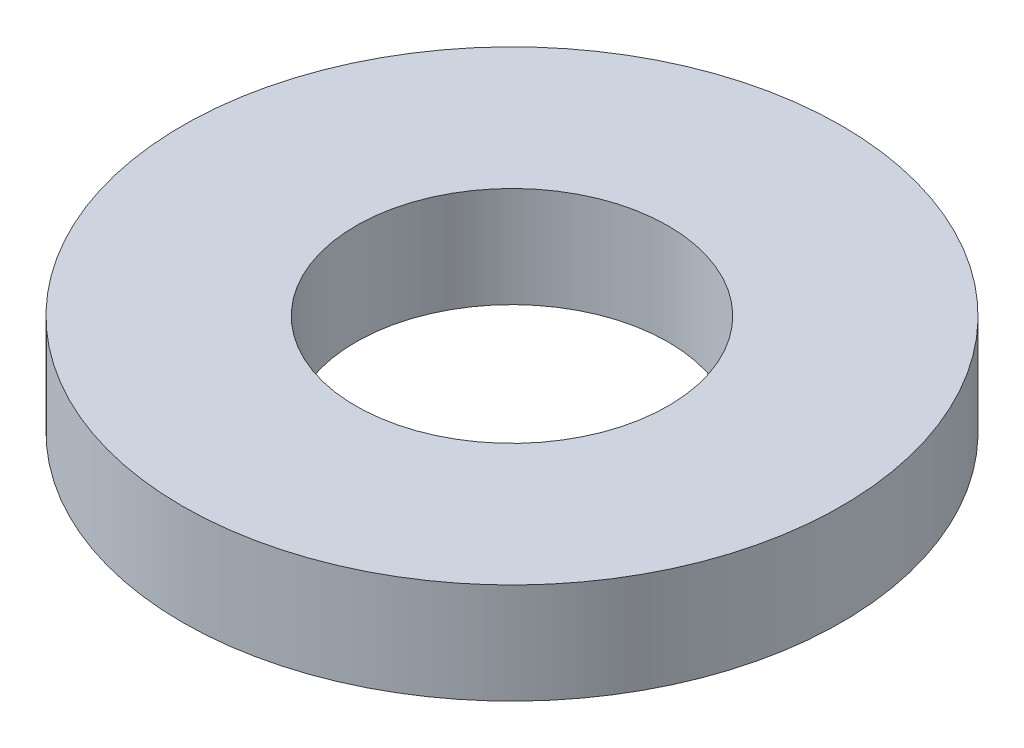
from build123d import *

# Parameters (mm, degrees)
SKETCH1_R           = 95
BOSS_EXTRUDE1_DEPTH = 29
SKETCH2_R           = 45
CUT_EXTRUDE1_DEPTH  = 138.444534267


with BuildPart() as part:
    # Sketch1 → Boss-Extrude1 (new body)
    with BuildSketch(Plane(origin=(0, 0, 0), x_dir=(1, 0, 0), z_dir=(0, 1, 0))):
        Circle(SKETCH1_R)
    extrude(amount=BOSS_EXTRUDE1_DEPTH)

    # Sketch2 → Cut-Extrude1 (cut, through all)
    with BuildSketch(Plane(origin=(0, 0, 0), x_dir=(1, 0, 0), z_dir=(0, 1, 0))):
        Circle(SKETCH2_R)
    extrude(amount=CUT_EXTRUDE1_DEPTH, mode=Mode.SUBTRACT)


solid = part.part
